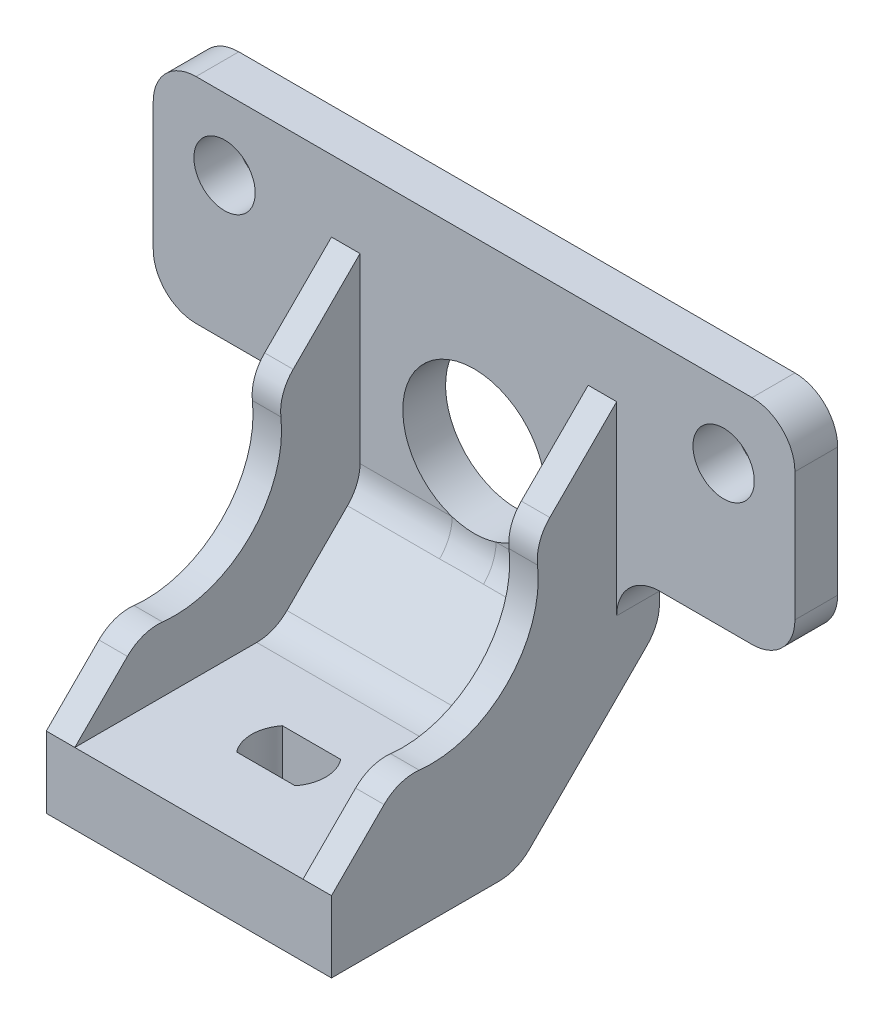
from build123d import *

# Parameters (mm, degrees)
SKETCH1_W               = 45
SKETCH1_H               = 30
SKETCH1_R               = 2.15
SKETCH1_R_2             = 5
BOSS_EXTRUDE1_DEPTH     = 3
SKETCH3_W               = 20
SKETCH3_H               = 5
EXTRUDE_THIN1_DEPTH     = 10
CUT_EXTRUDE1_DEPTH      = 41.746165464
BOSS_EXTRUDE2_DEPTH     = 2
SKETCH6_W               = 3
SKETCH6_H               = 15
CUT_EXTRUDE2_DEPTH      = 48.013295992
CHAMFER2_SIZE           = 6
CHAMFER1_SIZE           = 10
SKETCH8_R               = 4.5
SKETCH8_R_2             = 2.5
EXTRUDE_THIN3_DEPTH     = 2.5
MOVE_START              = -27.5
MOVE_FACE1_DEPTH        = 7.5
MOVE_FACE1_2_DEPTH      = 2.5
CUT_EXTRUDE3_DEPTH      = 43.32611487
CUT_EXTRUDE3_DEPTH_BACK = 43.32611487
SKETCH11_R              = 7.5
FILLET1_R               = 3


# Read off the part's stored shape, not the designer's step: Move Face1
with BuildPart() as part:
    # Sketch1 → Boss-Extrude1 (new body)
    with BuildSketch(Plane.XY):
        with Locations((0, -10)):
            Rectangle(SKETCH1_W, SKETCH1_H)
        with Locations((-17.5, 0)):
            Circle(SKETCH1_R, mode=Mode.SUBTRACT)
        with Locations(Location((17.5, 0, 0), (0, 0, 180))):
            Circle(SKETCH1_R, mode=Mode.SUBTRACT)
        with Locations((0, -8)):
            Circle(SKETCH1_R_2, mode=Mode.SUBTRACT)
    extrude(amount=BOSS_EXTRUDE1_DEPTH)

    # Sketch3 → Extrude-Thin1 (add, symmetric)
    with BuildSketch(Plane.ZY):
        with Locations((13, -22.5)):
            Rectangle(SKETCH3_W, SKETCH3_H)
    extrude(amount=EXTRUDE_THIN1_DEPTH, both=True)

    # Sketch4 → Cut-Extrude1 (cut, through all)
    with BuildSketch(Plane(origin=(0, -20, 0), x_dir=(1, 0, 0), z_dir=(0, 1, 0))):
        with BuildLine():
            Line((-2, -14.5), (2, -14.5))
            ThreePointArc((2, -14.5), (2.5, -16), (2, -17.5))
            Line((2, -17.5), (-2, -17.5))
            ThreePointArc((-2, -17.5), (-2.5, -16), (-2, -14.5))
        make_face()
    extrude(amount=-CUT_EXTRUDE1_DEPTH, mode=Mode.SUBTRACT)

    # Sketch5 → Boss-Extrude2 (add)
    with BuildSketch(Plane.ZY.offset(10)):
        Polygon((23, -20), (3, 0), (3, -20), align=None)
    boss_extrude2 = extrude(amount=-BOSS_EXTRUDE2_DEPTH)

    # Sketch6 → Cut-Extrude2 (cut, through all)
    with BuildSketch(Plane.ZY.offset(10)):
        with Locations((1.5, -17.5)):
            Rectangle(SKETCH6_W, SKETCH6_H)
    cut_extrude2 = extrude(amount=CUT_EXTRUDE2_DEPTH, mode=Mode.SUBTRACT)

    # Mirror1: Boss-Extrude2, Cut-Extrude2 across plane
    add(boss_extrude2.mirror(Plane(origin=(0, 0, 0), x_dir=(0, 0, 1), z_dir=(1, 0, 0))))
    add(cut_extrude2.mirror(Plane(origin=(0, 0, 0), x_dir=(0, 0, 1), z_dir=(1, 0, 0))), mode=Mode.SUBTRACT)

    # Chamfer2
    chamfer2_edges = [part.edges().sort_by_distance(p)[0] for p in [
        (0, -20, 3),
    ]]
    chamfer(chamfer2_edges, length=CHAMFER2_SIZE)

    # Chamfer1
    chamfer1_edges = [part.edges().sort_by_distance(p)[0] for p in [
        (0, -25, 0),
    ]]
    chamfer(chamfer1_edges, length=CHAMFER1_SIZE)

    # Sketch8 → Extrude-Thin3 (add)
    with BuildSketch(Plane.XZ.offset(25)):
        with Locations((0, 16)):
            Circle(SKETCH8_R)
        with Locations((0, 16)):
            Circle(SKETCH8_R_2, mode=Mode.SUBTRACT)
    extrude(amount=EXTRUDE_THIN3_DEPTH)

    # Move Face1 outline → Move Face1 (cut)
    with BuildSketch(Plane(origin=(0, 0, 0), x_dir=(1, 0, 0), z_dir=(0, 1, 0)).offset(MOVE_START)):
        with BuildLine():
            ThreePointArc((2.049390153, -17.6), (2.6, -16), (2.049390153, -14.4))
            Line((2.049390153, -14.4), (-2.049390153, -14.4))
            ThreePointArc((-2.049390153, -14.4), (-2.6, -16), (-2.049390153, -17.6))
            Line((-2.049390153, -17.6), (2.049390153, -17.6))
        make_face()
        with BuildLine():
            Line((2, -17.5), (-2, -17.5))
            ThreePointArc((-2, -17.5), (-2.5, -16), (-2, -14.5))
            Line((-2, -14.5), (2, -14.5))
            ThreePointArc((2, -14.5), (2.5, -16), (2, -17.5))
        make_face(mode=Mode.SUBTRACT)
    extrude(amount=MOVE_FACE1_DEPTH, mode=Mode.SUBTRACT)

    # Move Face1 2 outline → Move Face1 2 (cut)
    with BuildSketch(Plane(origin=(0, 0, 0), x_dir=(1, 0, 0), z_dir=(0, 1, 0)).offset(MOVE_START)):
        with BuildLine():
            Line((1.920937271, -14.4), (2.049390153, -14.4))
            ThreePointArc((2.049390153, -14.4), (0, -13.4), (-2.049390153, -14.4))
            Line((-2.049390153, -14.4), (-1.920937271, -14.4))
            ThreePointArc((-1.920937271, -14.4), (0, -13.5), (1.920937271, -14.4))
        make_face()
        with BuildLine():
            ThreePointArc((-2.049390153, -17.6), (0, -18.6), (2.049390153, -17.6))
            Line((2.049390153, -17.6), (1.920937271, -17.6))
            ThreePointArc((1.920937271, -17.6), (0, -18.5), (-1.920937271, -17.6))
            Line((-1.920937271, -17.6), (-2.049390153, -17.6))
        make_face()
    extrude(amount=MOVE_FACE1_2_DEPTH, mode=Mode.SUBTRACT)

    # Sketch11 → Cut-Extrude3 (cut, two sides: drawn at the far end of the back side and taken through both)
    with BuildSketch(Plane(origin=(0, 0, 0), x_dir=(0, 0, -1), z_dir=(1, 0, 0)).offset(-CUT_EXTRUDE3_DEPTH_BACK)):
        with Locations((-16, -8)):
            Circle(SKETCH11_R)
    extrude(amount=CUT_EXTRUDE3_DEPTH + CUT_EXTRUDE3_DEPTH_BACK, mode=Mode.SUBTRACT)

    # Fillet1
    fillet1_edges = [part.edges().sort_by_distance(p)[0] for p in [
        (0, -20, 9),
        (0, -14, 3),
        (0, -25, 10),
        (0, -15, 0),
        (-9, -15.177071733, 18.177071733),
        (-9, -5.822928267, 8.822928267),
        (9, -15.177071733, 18.177071733),
        (9, -5.822928267, 8.822928267),
        (-10, -10, 1.5),
        (-22.5, -10, 1.5),
        (-22.5, 5, 1.5),
        (22.5, 5, 1.5),
        (22.5, -10, 1.5),
        (10, -10, 1.5),
    ]]
    fillet(fillet1_edges, radius=FILLET1_R)


solid = part.part
